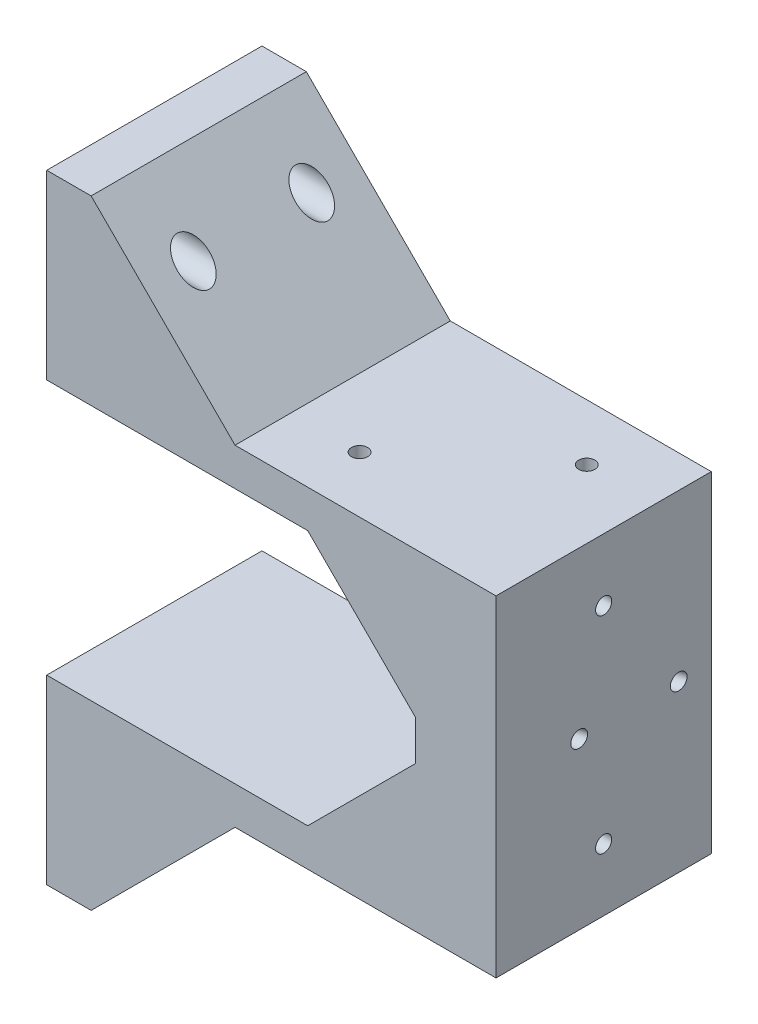
from build123d import *

# Parameters (mm, degrees)
BOSS_EXTRUDE1_DEPTH = 40
CHAMFER1_SIZE       = 20
CHAMFER2_SIZE       = 30
SKETCH2_R           = 3.25
CUT_EXTRUDE1_DEPTH  = 32
CUT_EXTRUDE5_START  = 5
SKETCH2_3_R         = 3.25
CUT_EXTRUDE5_DEPTH  = 32
SKETCH5_R           = 1.65
CUT_EXTRUDE2_DEPTH  = 109.988531507
SKETCH6_R           = 3
CUT_EXTRUDE3_DEPTH  = 76.5
SKETCH7_R           = 1.5
CUT_EXTRUDE4_DEPTH  = 10
SKETCH8_R           = 1.5
CUT_EXTRUDE6_DEPTH  = 76.478231012
CUT_EXTRUDE7_DEPTH  = 93.643917135
SKETCH10_R          = 1.5
CUT_EXTRUDE8_DEPTH  = 5


with BuildPart() as part:
    # Sketch1 → Boss-Extrude1 (new body)
    with BuildSketch(Plane.XY):
        Polygon((10, 57.5), (15, 57.5), (15, 30.75), (93.5, 30.75), (93.5, 0), (78.5, 0), (78.5, 23.75), (10, 23.75), align=None)
    boss_extrude1 = extrude(amount=-BOSS_EXTRUDE1_DEPTH)

    # Mirror1: Boss-Extrude1 across plane
    add(boss_extrude1.mirror(Plane(origin=(78.5, 0, -40), x_dir=(0, 0, 1), z_dir=(0, -1, 0))))

    # Chamfer1
    chamfer1_edges = [part.edges().sort_by_distance(p)[0] for p in [
        (78.5, 23.75, -20),
        (78.5, -23.75, -20),
    ]]
    chamfer(chamfer1_edges, length=CHAMFER1_SIZE)

    # Chamfer2
    # the kernel refuses this chamfer: 30 mm, written as the material it adds along each edge
    with BuildSketch(Plane(origin=(15, 30.75, 0), x_dir=(0.9996219169112968, -0.02749587661058632, 0), z_dir=(0, 0, -1))) as chamfer2_piece_1_section:
        Polygon((CHAMFER2_SIZE * 0.999621916911, -CHAMFER2_SIZE * 0.0274958766106), (-CHAMFER2_SIZE * 0.0274958766106, -CHAMFER2_SIZE * 0.999621916911), (0, 0), align=None)
    chamfer2_piece_1 = extrude(amount=40, mode=Mode.PRIVATE)
    chamfer2_piece_1 = split(chamfer2_piece_1, bisect_by=Plane(origin=(25.097042378, 57.5, -20), z_dir=(0, -1, 0)), keep=Keep.TOP, mode=Mode.PRIVATE)
    add(chamfer2_piece_1)
    with BuildSketch(Plane(origin=(15, -30.75, 0), x_dir=(-0.02749587661058655, -0.9996219169112968, 0), z_dir=(0, 0, -1))) as chamfer2_piece_2_section:
        Polygon((CHAMFER2_SIZE * 0.999621916911, -CHAMFER2_SIZE * 0.0274958766106), (-CHAMFER2_SIZE * 0.0274958766106, -CHAMFER2_SIZE * 0.999621916911), (0, 0), align=None)
    chamfer2_piece_2 = extrude(amount=40, mode=Mode.PRIVATE)
    chamfer2_piece_2 = split(chamfer2_piece_2, bisect_by=Plane(origin=(25.097042378, -57.5, -20), z_dir=(0, 1, 0)), keep=Keep.TOP, mode=Mode.PRIVATE)
    add(chamfer2_piece_2)

    # Sketch2 → Cut-Extrude1 (cut)
    with BuildSketch(Plane(origin=(51.601375419, 0, -14.7964563), x_dir=(0, -1, 0), z_dir=(0.9612616959383188, 0, -0.27563735581699983))):
        with Locations(Location((0, -10.918329477, 0), (0, 0, 270))):
            Circle(SKETCH2_R)
    extrude(amount=CUT_EXTRUDE1_DEPTH, mode=Mode.SUBTRACT)

    # Sketch2<3> → Cut-Extrude5 (cut)
    with BuildSketch(Plane(origin=(51.601375419, 0, -14.7964563), x_dir=(0, -1, 0), z_dir=(0.9612616959383188, 0, -0.27563735581699983)).offset(CUT_EXTRUDE5_START)):
        with Locations(Location((0, 6.865011898, 0), (0, 0, 270))):
            Circle(SKETCH2_3_R)
    extrude(amount=CUT_EXTRUDE5_DEPTH, mode=Mode.SUBTRACT)

    # Sketch5 → Cut-Extrude2 (cut, through all)
    with BuildSketch(Plane(origin=(93.5, 0, 0), x_dir=(0, 0, -1), z_dir=(1, 0, 0))):
        with Locations((31, -47.5)):
            Circle(SKETCH5_R)
        with Locations((9, -47.5)):
            Circle(SKETCH5_R)
        with Locations((9, 47.5)):
            Circle(SKETCH5_R)
        with Locations((31, 47.5)):
            Circle(SKETCH5_R)
    extrude(amount=-CUT_EXTRUDE2_DEPTH, mode=Mode.SUBTRACT)

    # Sketch6 → Cut-Extrude3 (cut)
    with BuildSketch(Plane(origin=(93.5, 0, 0), x_dir=(0, 0, -1), z_dir=(1, 0, 0))):
        with Locations(Location((31, -47.5, 0), (0, 0, 90))):
            Circle(SKETCH6_R)
        with Locations(Location((9, -47.5, 0), (0, 0, 90))):
            Circle(SKETCH6_R)
        with Locations(Location((31, 47.5, 0), (0, 0, 270))):
            Circle(SKETCH6_R)
        with Locations(Location((9, 47.5, 0), (0, 0, 270))):
            Circle(SKETCH6_R)
    extrude(amount=-CUT_EXTRUDE3_DEPTH, mode=Mode.SUBTRACT)

    # Sketch7 → Cut-Extrude4 (cut)
    with BuildSketch(Plane(origin=(93.5, 0, 0), x_dir=(0, 0, -1), z_dir=(1, 0, 0))):
        with Locations((20, -19.166666667)):
            Circle(SKETCH7_R)
        with Locations((20, 19.166666667)):
            Circle(SKETCH7_R)
    extrude(amount=-CUT_EXTRUDE4_DEPTH, mode=Mode.SUBTRACT)

    # Sketch8 → Cut-Extrude6 (cut, through all)
    with BuildSketch(Plane(origin=(51.601375419, 0, -14.7964563), x_dir=(0, -1, 0), z_dir=(0.9612616959383188, 0, -0.27563735581699983))):
        with Locations(Location((0, -10.918329477, 0), (0, 0, 270))):
            Circle(SKETCH8_R)
        with Locations(Location((0, 6.865011898, 0), (0, 0, 270))):
            Circle(SKETCH8_R)
    extrude(amount=CUT_EXTRUDE6_DEPTH, mode=Mode.SUBTRACT)

    # Sketch9 → Cut-Extrude7 (cut, through all)
    with BuildSketch(Plane(origin=(77.713455589, 0, -13.702978984), x_dir=(-0.17364817766693075, 0, -0.9848077530122081), z_dir=(0.9848077530122081, 0, -0.17364817766693075))):
        with BuildLine():
            Line((4.81351977, -13.75), (14.81351977, -13.75))
            Line((14.81351977, -13.75), (30.80281724, -13.75))
            Line((30.80281724, -13.75), (30.80281724, 13.75))
            Line((30.80281724, 13.75), (6.250897221, 13.75))
            Line((6.250897221, 13.75), (4.81351977, 13.75))
            ThreePointArc((4.81351977, 13.75), (-8.93648023, 0), (4.81351977, -13.75))
        make_face()
    extrude(amount=-CUT_EXTRUDE7_DEPTH, mode=Mode.SUBTRACT)

    # Sketch10 → Cut-Extrude8 (cut)
    with BuildSketch(Plane(origin=(0, 30.75, 0), x_dir=(1, 0, 0), z_dir=(0, 1, 0))):
        with Locations(Location((80.822063113, 29.543969578, 0), (0, 0, 270))):
            Circle(SKETCH10_R)
        with Locations(Location((57.677936887, 10.456030422, 0), (0, 0, 270))):
            Circle(SKETCH10_R)
    extrude(amount=-CUT_EXTRUDE8_DEPTH, mode=Mode.SUBTRACT)


solid = part.part
